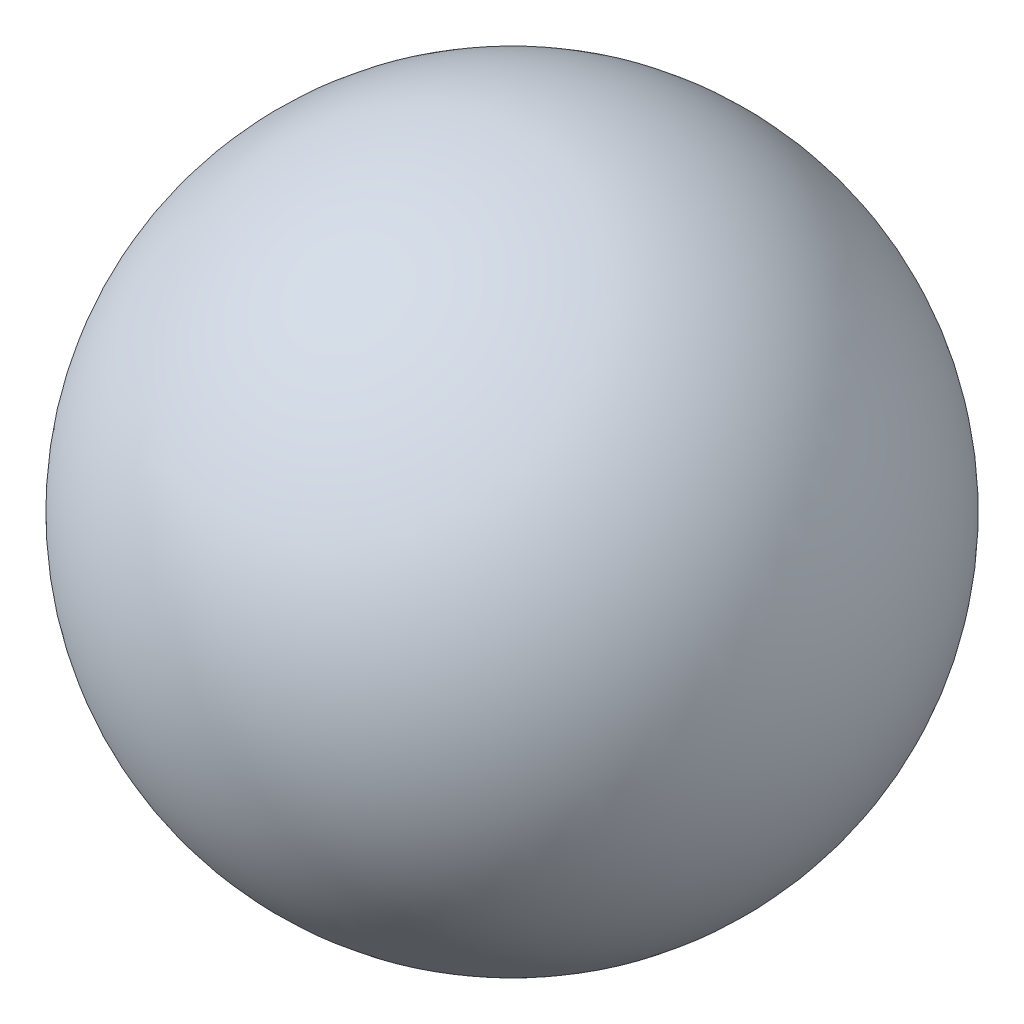
from build123d import *


with BuildPart() as part:
    # Sketch1 → Revolve1 (revolve)
    with BuildSketch(Plane.XY):
        with BuildLine():
            Line((0, 4), (0, -4))
            ThreePointArc((0, -4), (4, 0), (0, 4))
        make_face()
    revolve(axis=Axis((0, 4, 0), (0, -1, 0)))


solid = part.part
